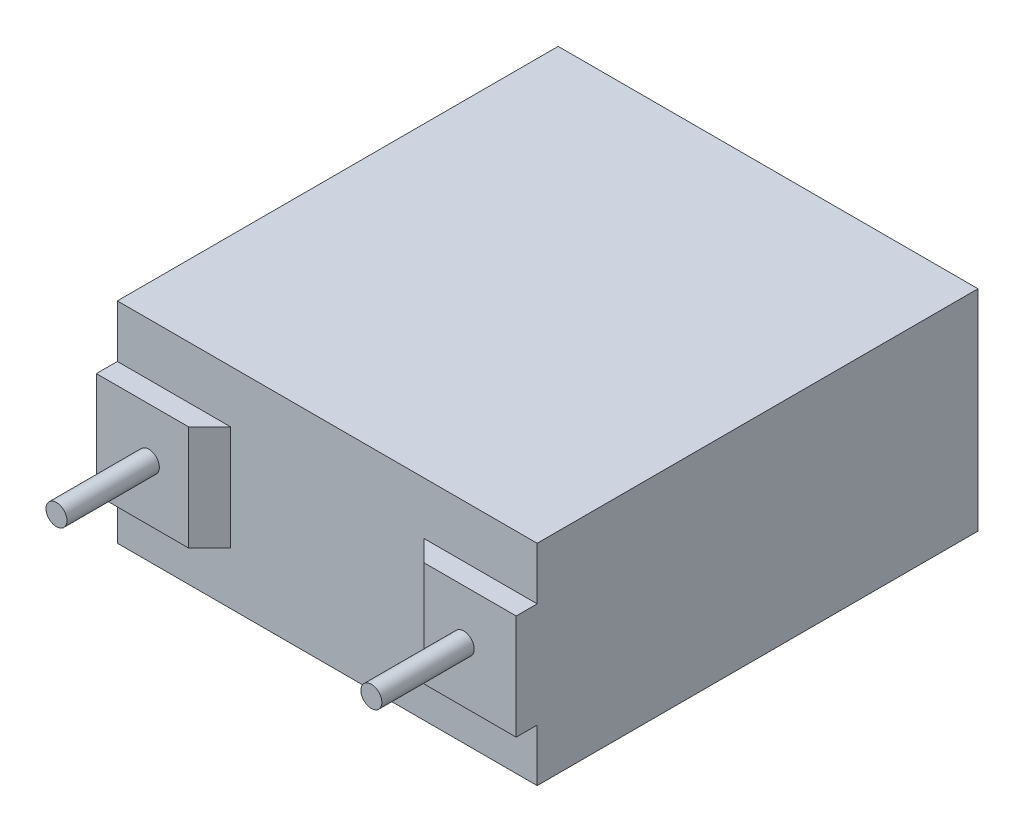
from build123d import *

# Parameters (mm, degrees)
SKETCH1_W           = 10
SKETCH1_H           = 5
BOSS_EXTRUDE1_DEPTH = 10.5
SKETCH2_W           = 2.2
SKETCH2_H           = 2.5
BOSS_EXTRUDE2_DEPTH = 0.5
CHAMFER1_SIZE       = 0.5
SKETCH4_R           = 0.25
BOSS_EXTRUDE3_DEPTH = 2.2


with BuildPart() as part:
    # Sketch1 → Boss-Extrude1 (new body)
    with BuildSketch(Plane.XY):
        Rectangle(SKETCH1_W, SKETCH1_H)
    extrude(amount=-BOSS_EXTRUDE1_DEPTH)

    # Sketch2 → Boss-Extrude2 (add)
    with BuildSketch(Plane.XY):
        with Locations((-3.9, 0)):
            Rectangle(SKETCH2_W, SKETCH2_H)
        with Locations((3.9, 0)):
            Rectangle(SKETCH2_W, SKETCH2_H)
    extrude(amount=BOSS_EXTRUDE2_DEPTH)

    # Chamfer1
    chamfer1_edges = [part.edges().sort_by_distance(p)[0] for p in [
        (2.8, 0, 0),
        (-2.8, 0, 0),
    ]]
    chamfer(chamfer1_edges, length=CHAMFER1_SIZE - 0.0001)  # a hair under: the kernel refuses the full size

    # Sketch4 → Boss-Extrude3 (add)
    with BuildSketch(Plane.XY.offset(0.5)):
        with Locations((-3.75, 0.065947188)):
            Circle(SKETCH4_R)
        with Locations(Location((3.75, 0.065947188, 0), (0, 0, 180))):
            Circle(SKETCH4_R)
    extrude(amount=BOSS_EXTRUDE3_DEPTH)


solid = part.part
